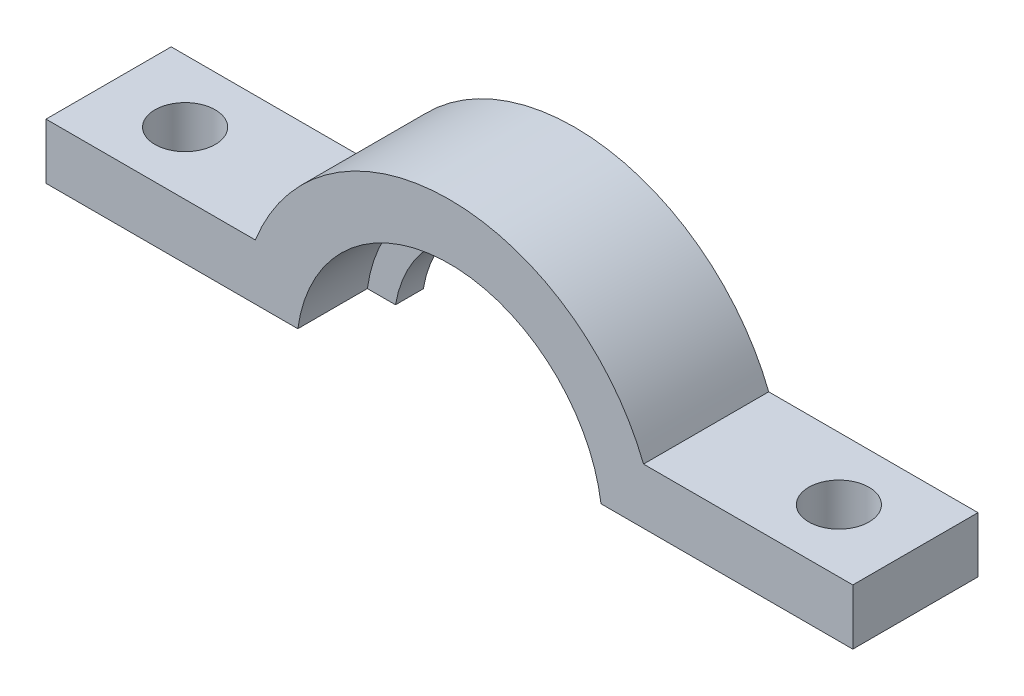
from build123d import *

# Parameters (mm, degrees)
BOSS_EXTRUDE1_DEPTH = 9
SKETCH2_R           = 2.165
CUT_EXTRUDE1_DEPTH  = 32.81587654
BOSS_EXTRUDE2_DEPTH = 2


with BuildPart() as part:
    # Sketch1 → Boss-Extrude1 (new body)
    with BuildSketch(Plane.XY):
        with BuildLine():
            Line((29, -13.075), (29, -9.075))
            Line((29, -9.075), (13.955285737, -9.075))
            ThreePointArc((13.955285737, -9.075), (0, 0.425), (-13.955285737, -9.075))
            Line((-13.955285737, -9.075), (-29, -9.075))
            Line((-29, -9.075), (-29, -13.075))
            Line((-29, -13.075), (-10.897247359, -13.075))
            ThreePointArc((-10.897247359, -13.075), (0, -3.575), (10.897247359, -13.075))
            Line((10.897247359, -13.075), (29, -13.075))
        make_face()
    extrude(amount=BOSS_EXTRUDE1_DEPTH)

    # Sketch2 → Cut-Extrude1 (cut, through all)
    with BuildSketch(Plane(origin=(0, -9.075, 0), x_dir=(1, 0, 0), z_dir=(0, 1, 0))):
        with Locations((-23.50000005, -4.5)):
            Circle(SKETCH2_R)
        with Locations((23.50000005, -4.5)):
            Circle(SKETCH2_R)
    extrude(amount=-CUT_EXTRUDE1_DEPTH, mode=Mode.SUBTRACT)

    # Sketch3 → Boss-Extrude2 (add)
    with BuildSketch(Plane(origin=(0, 0, 2), x_dir=(-1, 0, 0), z_dir=(0, 0, -1))):
        with BuildLine():
            Line((-10.897247359, -13.075), (-8.874119675, -13.075))
            ThreePointArc((-8.874119675, -13.075), (0, -5.575), (8.874119675, -13.075))
            Line((8.874119675, -13.075), (10.897247359, -13.075))
            ThreePointArc((10.897247359, -13.075), (0, -3.575), (-10.897247359, -13.075))
        make_face()
    extrude(amount=-BOSS_EXTRUDE2_DEPTH)


solid = part.part
